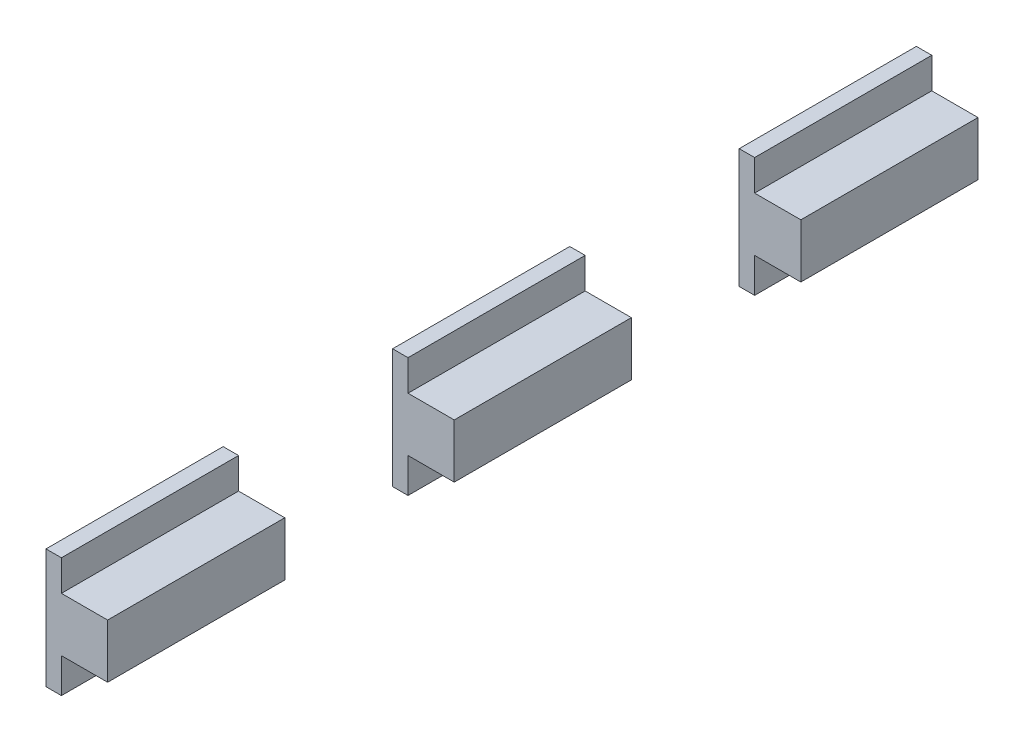
from build123d import *

# Parameters (mm, degrees)
AUFSATZ_LINEAR_START                = -0.4
AUFSATZ_LINEAR_AUSTRAGEN1_OUTLINE_W = 4.6
AUFSATZ_LINEAR_AUSTRAGEN1_OUTLINE_H = 3.1
AUFSATZ_LINEAR_AUSTRAGEN1_DEPTH     = 0.4
SKIZZE3_W                           = 4.6
SKIZZE3_H                           = 1.4
AUFSATZ_LINEAR_AUSTRAGEN2_DEPTH     = 1.2
LINEARES_MUSTER1_COUNT              = 3
LINEARES_MUSTER1_PITCH              = 9


# Read off the part's stored shape, not the designer's step: Aufsatz-Linear austragen1
with BuildPart() as part:
    # Aufsatz-Linear austragen1 outline → Aufsatz-Linear austragen1 (new body)
    with BuildSketch(Plane(origin=(87.8, 0, 0), x_dir=(0, 0, -1), z_dir=(1, 0, 0)).offset(AUFSATZ_LINEAR_START)):
        with Locations((34.89, 13.1)):
            Rectangle(AUFSATZ_LINEAR_AUSTRAGEN1_OUTLINE_W, AUFSATZ_LINEAR_AUSTRAGEN1_OUTLINE_H)
    extrude(amount=AUFSATZ_LINEAR_AUSTRAGEN1_DEPTH)

    # Skizze3 → Aufsatz-Linear austragen2 (add)
    with BuildSketch(Plane(origin=(87.8, 0, 0), x_dir=(0, 0, -1), z_dir=(1, 0, 0))):
        with Locations((34.89, 13.15)):
            Rectangle(SKIZZE3_W, SKIZZE3_H)
    extrude(amount=AUFSATZ_LINEAR_AUSTRAGEN2_DEPTH)


with BuildPart() as lineares_muster1_1:
    # Lineares Muster1: pattern copy
    add(part.part.moved(Location(Vector(0, 0, -1) * (1 * LINEARES_MUSTER1_PITCH))))


with BuildPart() as lineares_muster1_2:
    # Lineares Muster1: pattern copy
    add(part.part.moved(Location(Vector(0, 0, -1) * (2 * LINEARES_MUSTER1_PITCH))))


solid = Compound([part.part, lineares_muster1_1.part, lineares_muster1_2.part])
